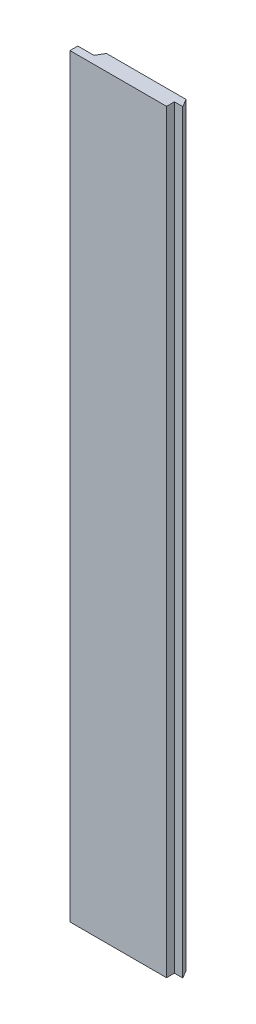
from build123d import *

# Parameters (mm, degrees)
SHAPE_DEPTH        = 1000
CUT_EXTRUDE7_REACH = 1003.96
SKETCH9_W          = 120
SKETCH9_H          = 136.851692929


with BuildPart() as part:
    # Sketch1 → Shape (new body)
    with BuildSketch(Plane(origin=(0, 0, 0), x_dir=(1, 0, 0), z_dir=(0, 1, 0))):
        Polygon((-41.5, 0), (-60, 0), (-60, -9), (50.5, -9), (50.5, 0), (60, 0), (54.803847577, 9), (-36.303847577, 9), align=None)
    extrude(amount=SHAPE_DEPTH)

    # Sketch9 → Cut-Extrude7 (cut, up to next)
    with BuildSketch(Plane(origin=(0, 0, -9), x_dir=(-1, 0, 0), z_dir=(0, 0, -1)), mode=Mode.PRIVATE) as cut_extrude7_sk1:
        with Locations((0, 931.574153536)):
            Rectangle(SKETCH9_W, SKETCH9_H)
    cut_extrude7_tool1 = extrude(cut_extrude7_sk1.sketch, amount=-CUT_EXTRUDE7_REACH, mode=Mode.PRIVATE) & part.part
    add(cut_extrude7_tool1.solids().sort_by_distance((0, 931.574154, -9))[0], mode=Mode.SUBTRACT)


solid = part.part
